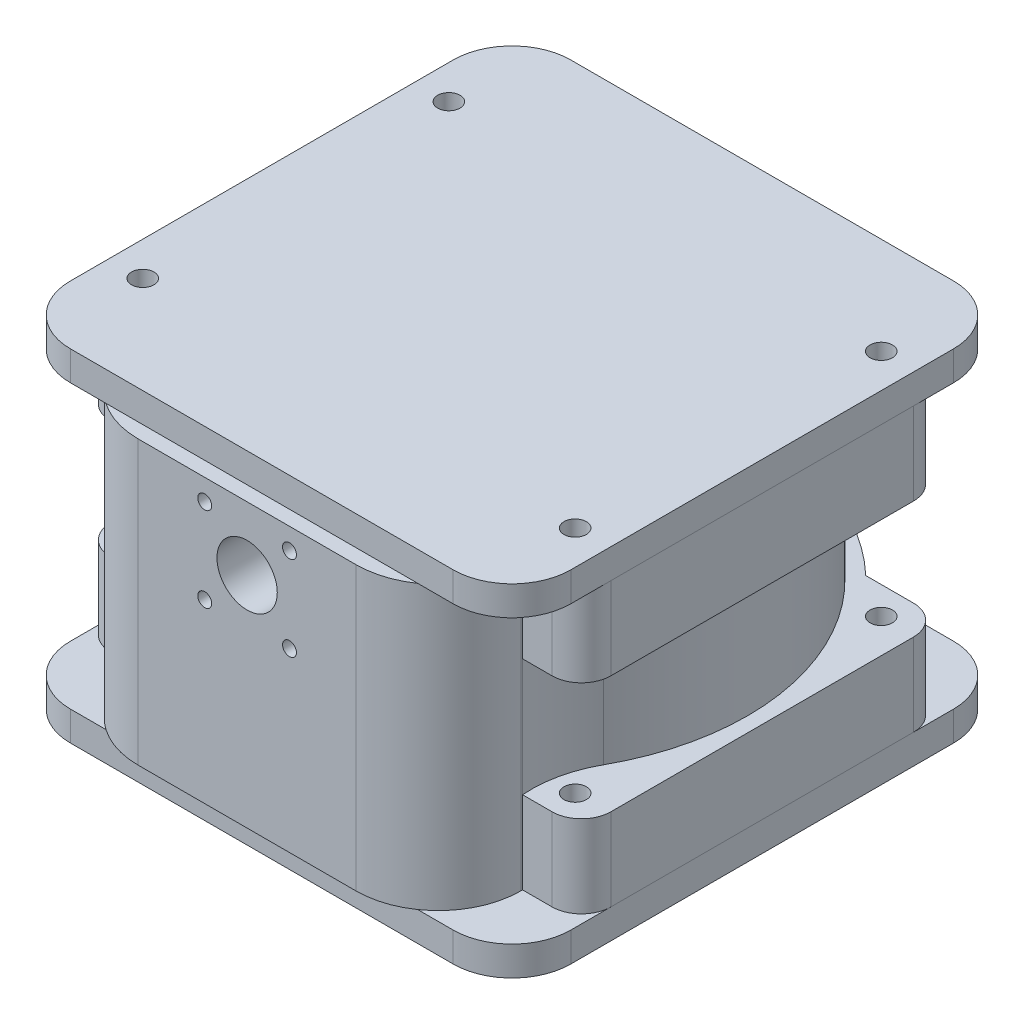
from build123d import *
from build123d.topology import SkipClean

# Parameters (mm, degrees)
SKETCH1_W                                    = 107.95
SKETCH1_H                                    = 107.95
BOSS_EXTRUDE1_DEPTH                          = 6.35
CSK_FOR_12_FLAT_HEAD_MACHINE_SCREW3_AT_COUNT = 2
CSK_FOR_12_FLAT_HEAD_MACHINE_SCREW3_AT_PITCH = 25.4
CSK_FOR_12_FLAT_HEAD_MACHINE_SCREW3_2_COUNT  = 2
CSK_FOR_12_FLAT_HEAD_MACHINE_SCREW3_2_PITCH  = 25.4
CSK_FOR_12_FLAT_HEAD_MACHINE_SCREW3_3_COUNT  = 2
CSK_FOR_12_FLAT_HEAD_MACHINE_SCREW3_3_PITCH  = 35.921024484
FILLET1_R                                    = 12.7
SKETCH12_R                                   = 39
SKETCH12_R_2                                 = 29
BOSS_EXTRUDE3_DEPTH                          = 6.35
CSK_FOR_M3_SFHCS1_AT_2_COUNT                 = 2
CSK_FOR_M3_SFHCS1_AT_2_PITCH                 = 58.889727457
CSK_FOR_M3_SFHCS1_AT_3_COUNT                 = 2
CSK_FOR_M3_SFHCS1_AT_3_PITCH                 = 68
CSK_FOR_M3_SFHCS1_AT_4_COUNT                 = 2
CSK_FOR_M3_SFHCS1_AT_4_PITCH                 = 34
SKETCH18_R                                   = 53.975
SKETCH18_R_2                                 = 41.275
BOSS_EXTRUDE4_DEPTH                          = 17.78
SKETCH21_R                                   = 49.2379
SKETCH21_R_2                                 = 45.72
CUT_EXTRUDE1_DEPTH                           = 2.54
SKETCH25_R                                   = 50.8
SKETCH25_R_2                                 = 41.275
BOSS_EXTRUDE6_DEPTH                          = 38.1
SKETCH26_W                                   = 38.1
SKETCH26_H                                   = 25.4
CUT_EXTRUDE3_DEPTH                           = 50.8
BOSS_EXTRUDE7_REACH                          = 140.328
SKETCH28_W                                   = 82.55
SKETCH28_H                                   = 60.96
SKETCH28_3_R                                 = 6.50875
CUT_EXTRUDE4_DEPTH                           = 25.4
SKETCH29_R                                   = 2.413
CUT_EXTRUDE5_DEPTH                           = 90.687989923
SKETCH32_R                                   = 50.8
SKETCH32_R_2                                 = 41.275
BOSS_EXTRUDE8_DEPTH                          = 5.08
SKETCH33_R                                   = 49.2887
SKETCH33_R_2                                 = 44.1325
CUT_EXTRUDE6_DEPTH                           = 2.54
BOSS_EXTRUDE9_DEPTH                          = 17.78
SKETCH35_R                                   = 2.413
CUT_EXTRUDE7_DEPTH                           = 20.32
SKETCH37_W                                   = 107.95
SKETCH37_H                                   = 107.95
SKETCH37_R                                   = 2.413
BOSS_EXTRUDE10_DEPTH                         = 6.35
FILLET2_R                                    = 12.7
FILLET3_R                                    = 25.4
FILLET4_R                                    = 6.35
FILLET5_R                                    = 17.78


with BuildPart() as part:
    # Sketch1 → Boss-Extrude1 (new body)
    with BuildSketch(Plane(origin=(0, 0, 0), x_dir=(1, 0, 0), z_dir=(0, 1, 0))):
        Rectangle(SKETCH1_W, SKETCH1_H)
    extrude(amount=BOSS_EXTRUDE1_DEPTH)

    # Sketch10 → CSK for #12 Flat Head Machine Screw3 (revolve, cut)
    with BuildSketch(Plane(origin=(12.7, 6.35, 12.7), x_dir=(0, 0, 1), z_dir=(1, 0, 0))):
        Polygon((0, 0), (0, 6.35), (2.8067, 6.35), (2.8067, 3.170300293), (5.5626, 0), align=None)
    csk_for_12_flat_head_machine_screw3 = revolve(axis=Axis((12.7, 12.7, 12.7), (0, -1, 0)), mode=Mode.SUBTRACT)

    # CSK for #12 Flat Head Machine Screw3 at: CSK for #12 Flat Head Machine Screw3 ×2
    with Locations(*[(0, 0, -i * CSK_FOR_12_FLAT_HEAD_MACHINE_SCREW3_AT_PITCH) for i in range(1, CSK_FOR_12_FLAT_HEAD_MACHINE_SCREW3_AT_COUNT)]):
        add(csk_for_12_flat_head_machine_screw3, mode=Mode.SUBTRACT)

    # CSK for _12 Flat Head Machine Screw3 2: CSK for #12 Flat Head Machine Screw3 ×2
    with Locations(*[(-i * CSK_FOR_12_FLAT_HEAD_MACHINE_SCREW3_2_PITCH, 0, 0) for i in range(1, CSK_FOR_12_FLAT_HEAD_MACHINE_SCREW3_2_COUNT)]):
        add(csk_for_12_flat_head_machine_screw3, mode=Mode.SUBTRACT)

    # CSK for _12 Flat Head Machine Screw3 3: CSK for #12 Flat Head Machine Screw3 ×2
    with Locations(*[Vector(-0.7071067811865476, 0, -0.7071067811865476) * (i * CSK_FOR_12_FLAT_HEAD_MACHINE_SCREW3_3_PITCH) for i in range(1, CSK_FOR_12_FLAT_HEAD_MACHINE_SCREW3_3_COUNT)]):
        add(csk_for_12_flat_head_machine_screw3, mode=Mode.SUBTRACT)

    # Fillet1
    fillet1_edges = [part.edges().sort_by_distance(p)[0] for p in [
        (53.975, 3.175, 53.975),
        (-53.975, 3.175, 53.975),
        (-53.975, 3.175, -53.975),
        (53.975, 3.175, -53.975),
    ]]
    fillet(fillet1_edges, radius=FILLET1_R)


with BuildPart() as body_2:
    # Sketch12 → Boss-Extrude3 (new body)
    with BuildSketch(Plane(origin=(0, 6.35, 0), x_dir=(1, 0, 0), z_dir=(0, 1, 0))):
        with Locations(Location((0, 0, 0), (0, 0, 270))):
            Circle(SKETCH12_R)
        with Locations(Location((0, 0, 0), (0, 0, 270))):
            Circle(SKETCH12_R_2, mode=Mode.SUBTRACT)
    extrude(amount=BOSS_EXTRUDE3_DEPTH)


with BuildPart() as csk_for_m3_sfhcs1_tool:
    # Sketch16 → CSK for M3 SFHCS1 (revolve)
    with BuildSketch(Plane(origin=(17, 0, -29.444863729), x_dir=(0, 0, -1), z_dir=(1, 0, 0))):
        Polygon((0, 0), (0, 12.7), (1.6, 12.7), (1.6, 1.76), (3.36, 0), align=None)
    csk_for_m3_sfhcs1 = revolve(axis=Axis((17, -6.35, -29.444863729), (0, 1, 0)))


with BuildPart() as part_1:
    add(part.part)

    # CSK for M3 SFHCS1: cut by csk_for_m3_sfhcs1_tool
    add(csk_for_m3_sfhcs1_tool.part, mode=Mode.SUBTRACT)


with BuildPart() as body_2_1:
    add(body_2.part)

    # CSK for M3 SFHCS1: cut by csk_for_m3_sfhcs1_tool
    add(csk_for_m3_sfhcs1_tool.part, mode=Mode.SUBTRACT)


with BuildPart() as csk_for_m3_sfhcs1_at_2_tool:
    # CSK for M3 SFHCS1 at 2: CSK for M3 SFHCS1 ×2
    with Locations(*[(0, 0, i * CSK_FOR_M3_SFHCS1_AT_2_PITCH) for i in range(1, CSK_FOR_M3_SFHCS1_AT_2_COUNT)]):
        add(csk_for_m3_sfhcs1)


with BuildPart() as part_2:
    add(part_1.part)

    # CSK for M3 SFHCS1 at 2: cut by csk_for_m3_sfhcs1_at_2_tool
    add(csk_for_m3_sfhcs1_at_2_tool.part, mode=Mode.SUBTRACT)


with BuildPart() as body_2_2:
    add(body_2_1.part)

    # CSK for M3 SFHCS1 at 2: cut by csk_for_m3_sfhcs1_at_2_tool
    add(csk_for_m3_sfhcs1_at_2_tool.part, mode=Mode.SUBTRACT)


with BuildPart() as csk_for_m3_sfhcs1_at_3_tool:
    # CSK for M3 SFHCS1 at 3: CSK for M3 SFHCS1 ×2
    with Locations(*[Vector(-0.5000000000000009, 0, 0.8660254037844382) * (i * CSK_FOR_M3_SFHCS1_AT_3_PITCH) for i in range(1, CSK_FOR_M3_SFHCS1_AT_3_COUNT)]):
        add(csk_for_m3_sfhcs1)


with BuildPart() as part_3:
    add(part_2.part)

    # CSK for M3 SFHCS1 at 3: cut by csk_for_m3_sfhcs1_at_3_tool
    add(csk_for_m3_sfhcs1_at_3_tool.part, mode=Mode.SUBTRACT)


with BuildPart() as body_2_3:
    add(body_2_2.part)

    # CSK for M3 SFHCS1 at 3: cut by csk_for_m3_sfhcs1_at_3_tool
    add(csk_for_m3_sfhcs1_at_3_tool.part, mode=Mode.SUBTRACT)


with BuildPart() as csk_for_m3_sfhcs1_at_4_tool:
    # CSK for M3 SFHCS1 at 4: CSK for M3 SFHCS1 ×2
    with Locations(*[(-i * CSK_FOR_M3_SFHCS1_AT_4_PITCH, 0, 0) for i in range(1, CSK_FOR_M3_SFHCS1_AT_4_COUNT)]):
        add(csk_for_m3_sfhcs1)


with BuildPart() as part_4:
    add(part_3.part)

    # CSK for M3 SFHCS1 at 4: cut by csk_for_m3_sfhcs1_at_4_tool
    add(csk_for_m3_sfhcs1_at_4_tool.part, mode=Mode.SUBTRACT)


with BuildPart() as body_2_4:
    add(body_2_3.part)

    # CSK for M3 SFHCS1 at 4: cut by csk_for_m3_sfhcs1_at_4_tool
    add(csk_for_m3_sfhcs1_at_4_tool.part, mode=Mode.SUBTRACT)


with BuildPart() as body_3:
    # Sketch18 → Boss-Extrude4 (new body)
    # profile 1 of 3: a face of its own
    with BuildSketch(Plane(origin=(0, 6.35, 0), x_dir=(1, 0, 0), z_dir=(0, 1, 0))):
        Circle(SKETCH18_R)
        with Locations(Location((0, 0, 0), (0, 0, 270))):
            Circle(SKETCH18_R_2, mode=Mode.SUBTRACT)
    # profile 2 of 3: a face of its own
    with BuildSketch(Plane(origin=(0, 6.35, 0), x_dir=(1, 0, 0), z_dir=(0, 1, 0))):
        with BuildLine():
            Line((-53.975, -38.989), (-13.545608292, -38.989))
            ThreePointArc((-13.545608292, -38.989), (-41.275, 0), (-13.545608292, 38.989))
            Line((-13.545608292, 38.989), (-53.975, 38.989))
            Line((-53.975, 38.989), (-53.975, -38.989))
        make_face()
    # profile 3 of 3: a face of its own
    with BuildSketch(Plane(origin=(0, 6.35, 0), x_dir=(1, 0, 0), z_dir=(0, 1, 0))):
        with BuildLine():
            Line((53.975, -38.989), (53.975, 38.989))
            Line((53.975, 38.989), (13.545608292, 38.989))
            ThreePointArc((13.545608292, 38.989), (41.275, 0), (13.545608292, -38.989))
            Line((13.545608292, -38.989), (53.975, -38.989))
        make_face()
    extrude(amount=BOSS_EXTRUDE4_DEPTH)

    # Sketch21 → Cut-Extrude1 (cut)
    with BuildSketch(Plane(origin=(0, 6.35, 0), x_dir=(1, 0, 0), z_dir=(0, 1, 0))):
        with Locations(Location((0, 0, 0), (0, 0, 270))):
            Circle(SKETCH21_R)
        with Locations(Location((0, 0, 0), (0, 0, 270))):
            Circle(SKETCH21_R_2, mode=Mode.SUBTRACT)
    extrude(amount=CUT_EXTRUDE1_DEPTH, mode=Mode.SUBTRACT)

    # Sketch25 → Boss-Extrude6 (add)
    with SkipClean():  # the faces are left unmerged after this step: merging them gives an invalid solid
        with BuildSketch(Plane(origin=(0, 24.13, 0), x_dir=(1, 0, 0), z_dir=(0, 1, 0))):
            with Locations(Location((0, 0, 0), (0, 0, 90))):
                Circle(SKETCH25_R)
            with Locations(Location((0, 0, 0), (0, 0, 270))):
                Circle(SKETCH25_R_2, mode=Mode.SUBTRACT)
        extrude(amount=BOSS_EXTRUDE6_DEPTH)

    # Sketch26 → Cut-Extrude3 (cut)
    with SkipClean():  # the faces are left unmerged after this step: merging them gives an invalid solid
        with BuildSketch(Plane.XY.offset(57.15)):
            with Locations((0, 62.23)):
                Rectangle(SKETCH26_W, SKETCH26_H)
        extrude(amount=-CUT_EXTRUDE3_DEPTH, mode=Mode.SUBTRACT)

    # Boss-Extrude7: up to this face of the body (flat: up to its plane)
    boss_extrude7_end = Plane(body_3.part.faces().sort_by_distance((45.650019283, 15.24, 38.989))[0])
    # Sketch28 → Boss-Extrude7 (add, up to the picked face)
    with BuildSketch(Plane.XY.offset(57.15), mode=Mode.PRIVATE) as boss_extrude7_sk1:
        with Locations((0, 36.83)):
            Rectangle(SKETCH28_W, SKETCH28_H)
        with BuildLine():
            Line((-9.144, 44.45), (-7.644, 44.45))
            ThreePointArc((-7.644, 44.45), (-10.204660172, 43.389339828), (-9.144, 45.95))
            Line((-9.144, 45.95), (-9.144, 44.45))
        make_face(mode=Mode.SUBTRACT)
        with BuildLine():
            Line((7.644, 44.45), (9.144, 44.45))
            Line((9.144, 44.45), (9.144, 45.95))
            ThreePointArc((9.144, 45.95), (10.204660172, 43.389339828), (7.644, 44.45))
        make_face(mode=Mode.SUBTRACT)
        with BuildLine():
            Line((9.144, 61.238), (9.144, 62.738))
            Line((9.144, 62.738), (7.644, 62.738))
            ThreePointArc((7.644, 62.738), (10.204660172, 63.798660172), (9.144, 61.238))
        make_face(mode=Mode.SUBTRACT)
        with BuildLine():
            Line((-7.644, 62.738), (-9.144, 62.738))
            Line((-9.144, 62.738), (-9.144, 61.238))
            ThreePointArc((-9.144, 61.238), (-10.204660172, 63.798660172), (-7.644, 62.738))
        make_face(mode=Mode.SUBTRACT)
    boss_extrude7_tool1 = split(extrude(boss_extrude7_sk1.sketch, amount=-BOSS_EXTRUDE7_REACH, mode=Mode.PRIVATE), bisect_by=boss_extrude7_end, keep=Keep.BOTH, mode=Mode.PRIVATE)
    add(boss_extrude7_tool1.solids().sort_by(Axis((0, 36.759058, 57.15), (0, 0, -1)))[0])

    # Sketch28<3> → Cut-Extrude4 (cut)
    with SkipClean():  # the faces are left unmerged after this step: merging them gives an invalid solid
        with BuildSketch(Plane.XY.offset(57.15)):
            with BuildLine():
                Line((-9.144, 45.95), (-9.144, 44.45))
                Line((-9.144, 44.45), (-7.644, 44.45))
                ThreePointArc((-7.644, 44.45), (-8.083339828, 45.510660172), (-9.144, 45.95))
            make_face()
            with BuildLine():
                ThreePointArc((9.144, 45.95), (8.083339828, 45.510660172), (7.644, 44.45))
                Line((7.644, 44.45), (9.144, 44.45))
                Line((9.144, 44.45), (9.144, 45.95))
            make_face()
            with BuildLine():
                Line((-9.144, 62.738), (-9.144, 61.238))
                ThreePointArc((-9.144, 61.238), (-8.083339828, 61.677339828), (-7.644, 62.738))
                Line((-7.644, 62.738), (-9.144, 62.738))
            make_face()
            with BuildLine():
                ThreePointArc((7.644, 62.738), (8.083339828, 61.677339828), (9.144, 61.238))
                Line((9.144, 61.238), (9.144, 62.738))
                Line((9.144, 62.738), (7.644, 62.738))
            make_face()
            with Locations((0, 53.594)):
                Circle(SKETCH28_3_R)
        extrude(amount=-CUT_EXTRUDE4_DEPTH, mode=Mode.SUBTRACT)


with BuildPart() as cut_extrude5_tool:
    # Sketch29 → Cut-Extrude5 (new, through all)
    with SkipClean():  # the faces are left unmerged after this step: merging them gives an invalid solid
        with BuildSketch(Plane(origin=(0, 24.13, 0), x_dir=(1, 0, 0), z_dir=(0, 1, 0))):
            with Locations(Location((-46.645493887, 33.02, 0), (0, 0, 270))):
                Circle(SKETCH29_R)
            with Locations(Location((-46.645493887, -33.02, 0), (0, 0, 270))):
                Circle(SKETCH29_R)
            with Locations(Location((46.645493887, -33.02, 0), (0, 0, 270))):
                Circle(SKETCH29_R)
            with Locations(Location((46.645493887, 33.02, 0), (0, 0, 270))):
                Circle(SKETCH29_R)
        extrude(amount=-CUT_EXTRUDE5_DEPTH)


with BuildPart() as part_5:
    with SkipClean():  # the faces are left unmerged after this step: merging them gives an invalid solid
        add(part_4.part)

        # Cut-Extrude5: cut by cut_extrude5_tool
        add(cut_extrude5_tool.part, mode=Mode.SUBTRACT)


with BuildPart() as body_3_1:
    with SkipClean():  # the faces are left unmerged after this step: merging them gives an invalid solid
        add(body_3.part)

        # Cut-Extrude5: cut by cut_extrude5_tool
        add(cut_extrude5_tool.part, mode=Mode.SUBTRACT)

    # Sketch32 → Boss-Extrude8 (add)
    with SkipClean():  # the faces are left unmerged after this step: merging them gives an invalid solid
        with BuildSketch(Plane(origin=(0, 62.23, 0), x_dir=(1, 0, 0), z_dir=(0, 1, 0))):
            Circle(SKETCH32_R)
            Circle(SKETCH32_R_2, mode=Mode.SUBTRACT)
        extrude(amount=BOSS_EXTRUDE8_DEPTH)

    # Sketch33 → Cut-Extrude6 (cut)
    with SkipClean():  # the faces are left unmerged after this step: merging them gives an invalid solid
        with BuildSketch(Plane(origin=(0, 67.31, 0), x_dir=(1, 0, 0), z_dir=(0, 1, 0))):
            with Locations(Location((0, 0, 0), (0, 0, 270))):
                Circle(SKETCH33_R)
            with Locations(Location((0, 0, 0), (0, 0, 270))):
                Circle(SKETCH33_R_2, mode=Mode.SUBTRACT)
        extrude(amount=-CUT_EXTRUDE6_DEPTH, mode=Mode.SUBTRACT)

    # Sketch34 → Boss-Extrude9 (add)
    with SkipClean():  # the faces are left unmerged after this step: merging them gives an invalid solid
        with BuildSketch(Plane(origin=(0, 67.31, 0), x_dir=(1, 0, 0), z_dir=(0, 1, 0))):
            with BuildLine():
                Line((53.975, 38.989), (37.325038567, 38.989))
                ThreePointArc((37.325038567, 38.989), (0, 53.975), (-37.325038567, 38.989))
                Line((-37.325038567, 38.989), (-53.975, 38.989))
                Line((-53.975, 38.989), (-53.975, -38.989))
                Line((-53.975, -38.989), (-32.565286411, -38.989))
                ThreePointArc((-32.565286411, -38.989), (0, 50.8), (32.565286411, -38.989))
                Line((32.565286411, -38.989), (53.975, -38.989))
                Line((53.975, -38.989), (53.975, 38.989))
            make_face()
        extrude(amount=-BOSS_EXTRUDE9_DEPTH)

    # Sketch35 → Cut-Extrude7 (cut)
    with SkipClean():  # the faces are left unmerged after this step: merging them gives an invalid solid
        with BuildSketch(Plane(origin=(0, 67.31, 0), x_dir=(1, 0, 0), z_dir=(0, 1, 0))):
            with Locations(Location((-46.645493887, -33.02, 0), (0, 0, 270))):
                Circle(SKETCH35_R)
            with Locations(Location((-46.645493887, 33.02, 0), (0, 0, 270))):
                Circle(SKETCH35_R)
            with Locations(Location((46.645493887, 33.02, 0), (0, 0, 270))):
                Circle(SKETCH35_R)
            with Locations(Location((46.645493887, -33.02, 0), (0, 0, 270))):
                Circle(SKETCH35_R)
        extrude(amount=-CUT_EXTRUDE7_DEPTH, mode=Mode.SUBTRACT)

    # Fillet3
    # the kernel refuses this fillet: 25.4 mm, written as the material it adds along each edge
    with BuildSketch(Plane(origin=(-32.565286411, 49.53, 38.989), x_dir=(-1, 0, 0), z_dir=(0, -1, 0))) as fillet3_piece_1:
        with BuildLine():
            CenterArc((34.033823573, 1.962002426), FILLET3_R, 150.927325657, 33.502853458)
            Line((11.834120245, 14.304334951), (11.390126179, 14.551181601))
            ThreePointArc((11.390126179, 14.551181601), (6.184640155, 6.930795822), (-0.325652864, 0.38989))
            Line((-0.325652864, 0.38989), (0, -0.508))
            ThreePointArc((0, -0.508), (4.354856795, -0.508), (8.20323139, -0.039240049))
            Line((8.20323139, -0.039240049), (8.709713589, 0))
        make_face()
    extrude(amount=25.4)
    with BuildSketch(Plane(origin=(32.565286411, 49.53, 38.989), x_dir=(1, 0, 0), z_dir=(0, -1, 0))) as fillet3_piece_2:
        with BuildLine():
            CenterArc((34.033823573, -1.962002426), FILLET3_R, 175.569820885, 33.502853458)
            Line((11.834120245, -14.304334951), (11.390126179, -14.551181601))
            ThreePointArc((11.390126179, -14.551181601), (6.184640155, -6.930795822), (-0.325652864, -0.38989))
            Line((-0.325652864, -0.38989), (0, 0.508))
            ThreePointArc((0, 0.508), (4.354856795, 0.508), (8.20323139, 0.039240049))
            Line((8.20323139, 0.039240049), (8.709713589, 0))
        make_face()
    extrude(amount=25.4)

    # Fillet4
    fillet4_edges = [body_3_1.edges().sort_by_distance(p)[0] for p in [
        (53.975, 15.24, -38.989),
        (53.975, 15.24, 38.989),
        (-53.975, 58.42, -38.989),
        (53.975, 58.42, -38.989),
        (53.975, 58.42, 38.989),
        (-53.975, 58.42, 38.989),
        (-53.975, 15.24, -38.989),
        (-53.975, 15.24, 38.989),
    ]]
    fillet(fillet4_edges, radius=FILLET4_R)

    # Fillet5
    fillet5_edges = [body_3_1.edges().sort_by_distance(p)[0] for p in [
        (-41.275, 36.83, 57.15),
        (41.275, 36.83, 57.15),
    ]]
    fillet(fillet5_edges, radius=FILLET5_R)


with BuildPart() as body_4:
    # Sketch37 → Boss-Extrude10 (new body)
    with BuildSketch(Plane(origin=(0, 67.31, 0), x_dir=(1, 0, 0), z_dir=(0, 1, 0))):
        Rectangle(SKETCH37_W, SKETCH37_H)
        with Locations(Location((46.645493887, -33.02, 0), (0, 0, 270))):
            Circle(SKETCH37_R, mode=Mode.SUBTRACT)
        with Locations(Location((-46.645493887, -33.02, 0), (0, 0, 270))):
            Circle(SKETCH37_R, mode=Mode.SUBTRACT)
        with Locations(Location((-46.645493887, 33.02, 0), (0, 0, 270))):
            Circle(SKETCH37_R, mode=Mode.SUBTRACT)
        with Locations(Location((46.645493887, 33.02, 0), (0, 0, 270))):
            Circle(SKETCH37_R, mode=Mode.SUBTRACT)
    extrude(amount=BOSS_EXTRUDE10_DEPTH)

    # Fillet2
    fillet2_edges = [body_4.edges().sort_by_distance(p)[0] for p in [
        (53.975, 70.485, 53.975),
        (-53.975, 70.485, 53.975),
        (-53.975, 70.485, -53.975),
        (53.975, 70.485, -53.975),
    ]]
    fillet(fillet2_edges, radius=FILLET2_R)


solid = Compound([body_2_4.part, part_5.part, body_3_1.part, body_4.part])
